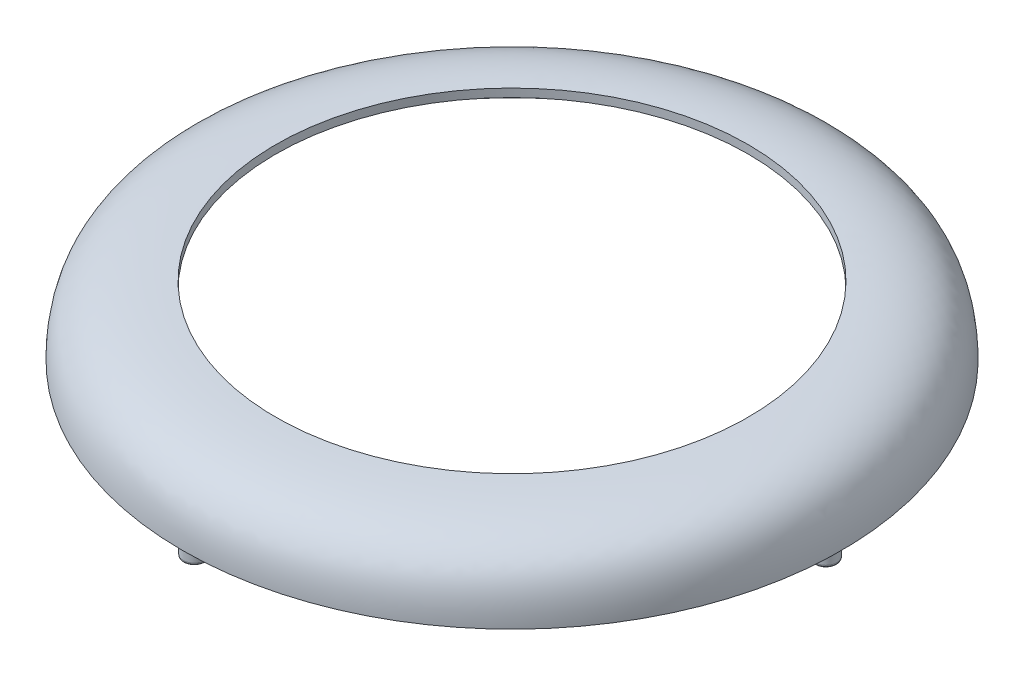
from build123d import *
from build123d.topology import SkipClean

# Parameters (mm, degrees)
BOSS_EXTRUDE1_REACH             = 173.537
SKETCH2_R                       = 4
BOSS_EXTRUDE1_DIRECTION_2_DEPTH = 5
FILLET1_R                       = 1
CIRPATTERN1_COUNT               = 4
FILLET1_OF_CIRPATTERN1_R        = 1


with BuildPart() as part:
    # Sketch1 → Revolve1 (revolve)
    with BuildSketch(Plane.XY):
        with BuildLine():
            Line((120, 0), (117, 0))
            add(Edge.make_bspline(
                [(117, 0), (117, 0.497497152), (116.986262169, 1.507832917), (116.902136822, 3.404611076), (116.687851434, 5.627176487), (116.250209749, 8.027978525), (115.42168448, 10.888982801), (113.929674225, 13.846720573), (111.306858378, 16.658211895), (108.12717348, 18.569818628), (104.821034458, 19.819850194), (101.939259689, 20.603494586), (98.636326369, 21.222815885), (94.902488463, 21.669859699), (91.41065321, 21.894810067), (88.407436668, 21.984956205), (86.793122341, 22), (86, 22)],
                knots=[0, 0, 0, 0, 0.03125, 0.0625, 0.125, 0.1875, 0.25, 0.375, 0.5, 0.625, 0.6875, 0.75, 0.8125, 0.875, 0.9375, 0.96875, 1, 1, 1, 1], degree=3))
            Line((86, 22), (86, 25))
            add(Edge.make_bspline(
                [(120, 0), (120, 17.123651826), (112.596256225, 25), (86, 25)],
                knots=[0, 0, 0, 0, 1, 1, 1, 1], degree=3))
        make_face()
    revolve(axis=Axis((0, 0, 0), (0, 1, 0)))

    # Sketch2 → Boss-Extrude1 (add, up to next)
    with BuildSketch(Plane(origin=(0, 0, 0), x_dir=(-1, 0, 0), z_dir=(0, -1, 0)), mode=Mode.PRIVATE) as boss_extrude1_sk1:
        with Locations((-0.704487, 114.997842145)):
            Circle(SKETCH2_R)
    boss_extrude1_tool1 = extrude(boss_extrude1_sk1.sketch, amount=-BOSS_EXTRUDE1_REACH, mode=Mode.PRIVATE) - part.part
    boss_extrude1 = boss_extrude1_tool1.solids().sort_by_distance((0.704487, 0, -114.997842))[0]
    add(boss_extrude1)

    # Sketch2 → Boss-Extrude1 direction 2 (add)
    with SkipClean():  # the faces are left unmerged after this step: merging them gives an invalid solid
        with BuildSketch(Plane(origin=(0, 0, 0), x_dir=(-1, 0, 0), z_dir=(0, -1, 0))):
            with Locations((-0.704487, 114.997842145)):
                Circle(SKETCH2_R)
        boss_extrude1_direction_2 = extrude(amount=BOSS_EXTRUDE1_DIRECTION_2_DEPTH)

    # Fillet1
    fillet1_edges = [part.edges().sort_by_distance(p)[0] for p in [
        (4.704487, -5, -114.997842145),
    ]]
    fillet(fillet1_edges, radius=FILLET1_R)

    # CirPattern1: Boss-Extrude1, Boss-Extrude1 direction 2 ×4 about axis
    cirpattern1_axis = Axis((0, 0, 0), (0, -1, 0))
    add([boss_extrude1.rotate(cirpattern1_axis, i * 360 / CIRPATTERN1_COUNT) for i in range(1, CIRPATTERN1_COUNT)])
    add([boss_extrude1_direction_2.rotate(cirpattern1_axis, i * 360 / CIRPATTERN1_COUNT) for i in range(1, CIRPATTERN1_COUNT)])

    # Fillet1 of CirPattern1
    fillet1_of_cirpattern1_edges = [part.edges().sort_by_distance(p)[0] for p in [
        (114.997842145, -5, 4.704487),
        (-4.704487, -5, 114.997842145),
        (-114.997842145, -5, -4.704487),
    ]]
    fillet(fillet1_of_cirpattern1_edges, radius=FILLET1_OF_CIRPATTERN1_R)


solid = part.part
